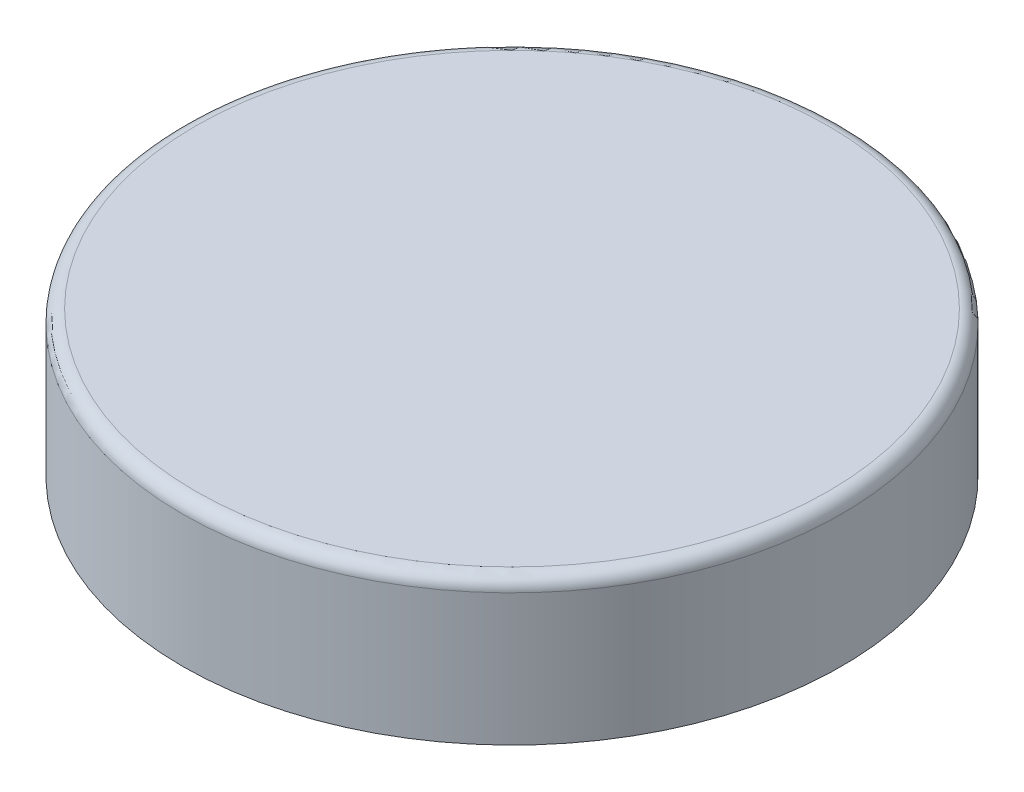
from build123d import *

# Parameters (mm, degrees)
SKETCH1_R           = 25
BOSS_EXTRUDE1_DEPTH = 11
FILLET1_R           = 1
SHELL1_T            = -1


with BuildPart() as part:
    # Sketch1 → Boss-Extrude1 (new body)
    with BuildSketch(Plane(origin=(0, 0, 0), x_dir=(1, 0, 0), z_dir=(0, 1, 0))):
        Circle(SKETCH1_R)
    extrude(amount=BOSS_EXTRUDE1_DEPTH)

    # Fillet1
    fillet1_edges = [part.edges().sort_by_distance(p)[0] for p in [
        (-25, 11, 0),
    ]]
    fillet(fillet1_edges, radius=FILLET1_R)

    # Shell1
    shell1_openings = [part.faces().sort_by_distance(p)[0] for p in [
        (0, 0, 0),
    ]]
    offset(amount=SHELL1_T, openings=shell1_openings, kind=Kind.INTERSECTION)


solid = part.part
